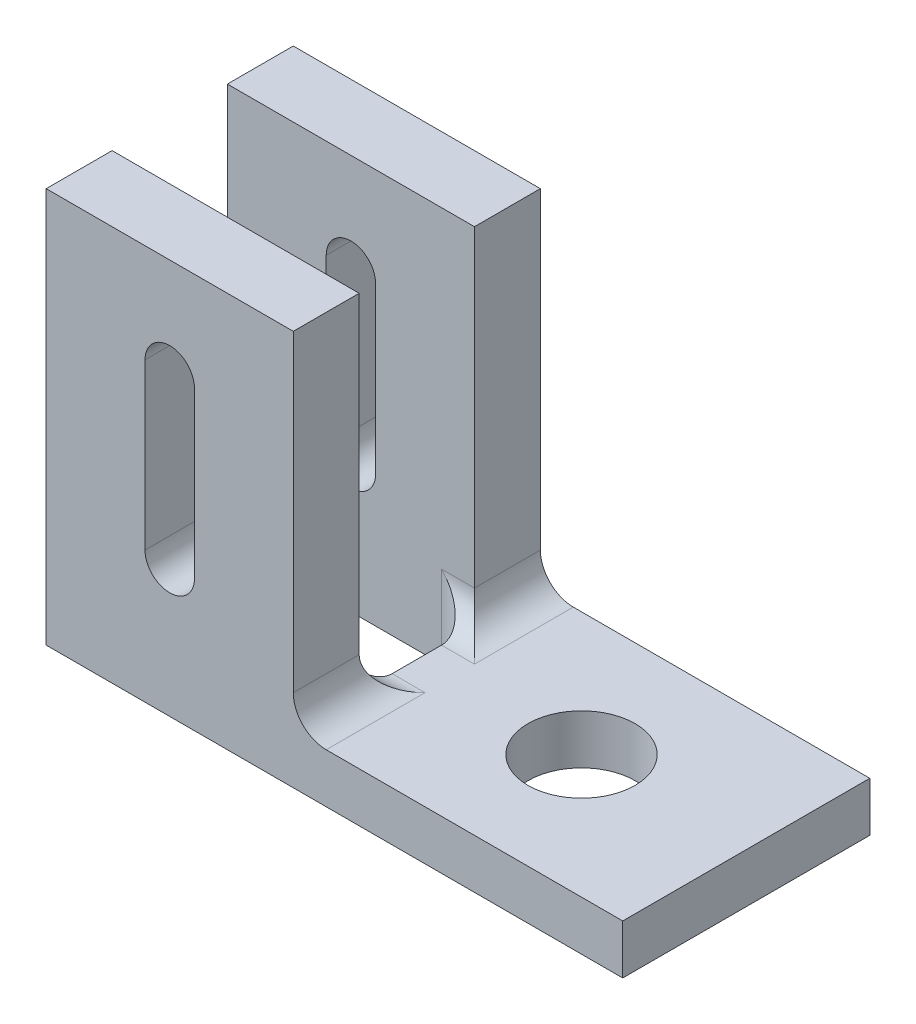
from build123d import *

# Parameters (mm, degrees)
EXTRUDE_1_DEPTH     = 15
SKETCH_2_R          = 3.25
SKETCH_2_W          = 10
SKETCH_2_H          = 7
CUT_EXTRUDE_1_DEPTH = 37
SKETCH_3_W          = 7
SKETCH_3_H          = 25
CUT_EXTRUDE_2_DEPTH = 37
FILLET_1_R          = 2
FILLET_2_R          = 2


with BuildPart() as part:
    # 草图1 → 凸台-拉伸1 (new body)
    with BuildSketch(Plane.XY):
        Polygon((-3.257989732, 3.83894099), (16.742010268, 3.83894099), (16.742010268, 0.83894099), (-18.257989732, 0.83894099), (-18.257989732, 24.83894099), (-3.257989732, 24.83894099), align=None)
        with BuildLine():
            Line((-12.257989732, 18.83894099), (-12.257989732, 8.83894099))
            ThreePointArc((-12.257989732, 8.83894099), (-10.757989732, 7.33894099), (-9.257989732, 8.83894099))
            Line((-9.257989732, 8.83894099), (-9.257989732, 18.83894099))
            ThreePointArc((-9.257989732, 18.83894099), (-10.757989732, 20.33894099), (-12.257989732, 18.83894099))
        make_face(mode=Mode.SUBTRACT)
    extrude(amount=EXTRUDE_1_DEPTH)

    # 草图2 → 切除-拉伸1 (cut)
    with BuildSketch(Plane(origin=(0, 24.83894099, 0), x_dir=(1, 0, 0), z_dir=(0, 1, 0))):
        with Locations(Location((6.742010268, -7.5, 0), (0, 0, 180))):
            Circle(SKETCH_2_R)
        with Locations((-13.257989732, -7.5)):
            Rectangle(SKETCH_2_W, SKETCH_2_H)
    extrude(amount=-CUT_EXTRUDE_1_DEPTH, mode=Mode.SUBTRACT)

    # 草图3 → 切除-拉伸2 (cut)
    with BuildSketch(Plane(origin=(-3.257989732, 0, 0), x_dir=(0, 0, -1), z_dir=(1, 0, 0))):
        with Locations((-7.5, 12.33894099)):
            Rectangle(SKETCH_3_W, SKETCH_3_H)
    extrude(amount=-CUT_EXTRUDE_2_DEPTH, mode=Mode.SUBTRACT)

    # 圆角1
    fillet_1_edges = [part.edges().sort_by_distance(p)[0] for p in [
        (-3.257989732, 2.33894099, 11),
        (-3.257989732, 2.33894099, 4),
    ]]
    fillet(fillet_1_edges, radius=FILLET_1_R)

    # 圆角2
    fillet_2_edges = [part.edges().sort_by_distance(p)[0] for p in [
        (-3.257989732, 3.83894099, 2),
        (-3.257989732, 3.83894099, 13),
        (-4.257989732, 3.83894099, 11),
        (-4.257989732, 3.83894099, 4),
    ]]
    fillet(fillet_2_edges, radius=FILLET_2_R - 0.0001)  # a hair under: the kernel refuses the full size


solid = part.part
